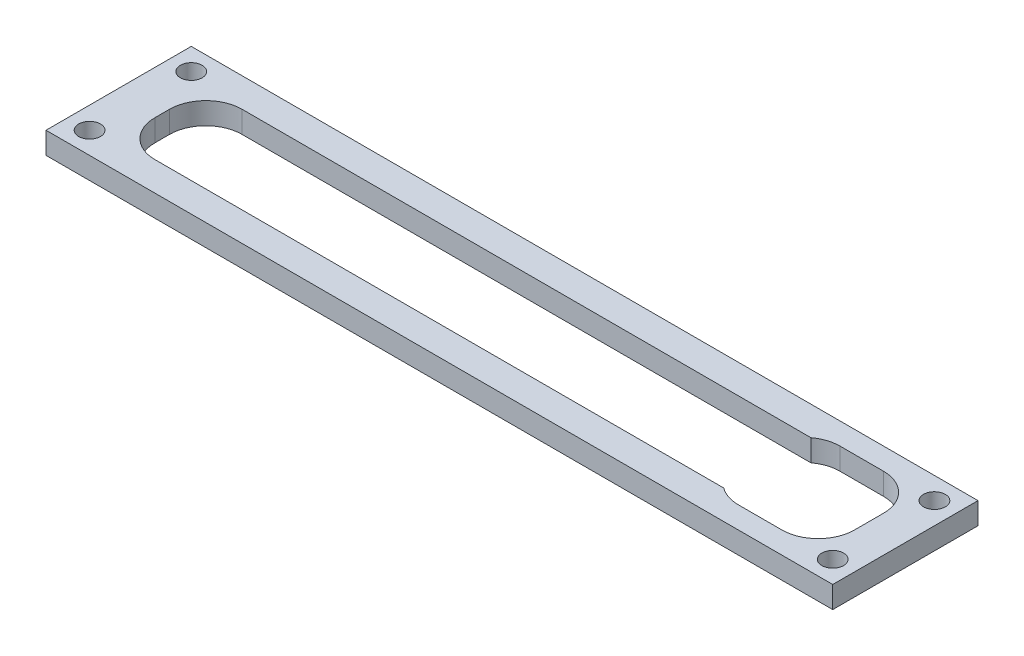
from build123d import *

# Parameters (mm, degrees)
SKETCH1_W           = 108.320866354
SKETCH1_H           = 20
SKETCH1_R           = 1.5
SKETCH1_W_2         = 96.320866354
SKETCH1_H_2         = 12
BOSS_EXTRUDE1_DEPTH = 3
CUT_EXTRUDE1_DEPTH  = 111.192604505
FILLET1_R           = 5


with BuildPart() as part:
    # Sketch1 → Boss-Extrude1 (new body)
    with BuildSketch(Plane(origin=(0, 0, 0), x_dir=(1, 0, 0), z_dir=(0, 1, 0))):
        with Locations((54.160433177, 10)):
            Rectangle(SKETCH1_W, SKETCH1_H)
        with Locations(Location((3, 17, 0), (0, 0, 270))):
            Circle(SKETCH1_R, mode=Mode.SUBTRACT)
        with Locations(Location((3, 3, 0), (0, 0, 90))):
            Circle(SKETCH1_R, mode=Mode.SUBTRACT)
        with Locations(Location((105.320866354, 3, 0), (0, 0, 270))):
            Circle(SKETCH1_R, mode=Mode.SUBTRACT)
        with Locations(Location((105.320866354, 17, 0), (0, 0, 90))):
            Circle(SKETCH1_R, mode=Mode.SUBTRACT)
        with Locations((54.160433177, 10)):
            Rectangle(SKETCH1_W_2, SKETCH1_H_2, mode=Mode.SUBTRACT)
    extrude(amount=BOSS_EXTRUDE1_DEPTH)

    # Sketch2 → Cut-Extrude1 (cut, through all)
    with BuildSketch(Plane(origin=(0, 3, 0), x_dir=(1, 0, 0), z_dir=(0, 1, 0))):
        Polygon((89.320866354, 17), (89.320866354, 16), (102.320866354, 16), (102.320866354, 4), (89.320866354, 4), (89.320866354, 3), (103.320866354, 3), (103.320866354, 17), align=None)
    extrude(amount=-CUT_EXTRUDE1_DEPTH, mode=Mode.SUBTRACT)

    # Fillet1
    # the kernel refuses this fillet: 5 mm, written as the material it adds along each edge
    with BuildSketch(Plane(origin=(103.320866354, 3, -17), x_dir=(0, 0, 1), z_dir=(0, -1, 0)), Plane(origin=(103.320866354, 3, -3), x_dir=(-1, 0, 0), z_dir=(0, -1, 0)), Plane(origin=(6, 0, -16), x_dir=(0, 0, 1), z_dir=(0, 1, 0))) as fillet1_piece_1:
        with BuildLine():
            CenterArc((FILLET1_R, FILLET1_R), FILLET1_R, 180, 90)
            Line((0, FILLET1_R), (-FILLET1_R * 0.02, FILLET1_R))
            Line((-FILLET1_R * 0.02, FILLET1_R), (-FILLET1_R * 0.02, -FILLET1_R * 0.02))
            Line((-FILLET1_R * 0.02, -FILLET1_R * 0.02), (FILLET1_R, -FILLET1_R * 0.02))
            Line((FILLET1_R, -FILLET1_R * 0.02), (FILLET1_R, 0))
        make_face()
    extrude(amount=3)
    with BuildSketch(Plane(origin=(89.320866354, 3, -17), x_dir=(1, 0, 0), z_dir=(0, -1, 0))) as fillet1_piece_2:
        with BuildLine():
            CenterArc((3, 5), FILLET1_R, 233.130102354, 36.869897646)
            Line((0, 1), (-0.06, 0.92))
            ThreePointArc((-0.06, 0.92), (-0.1, 0.5), (-0.1, 0))
            Line((-0.1, 0), (0, -0.1))
            Line((0, -0.1), (3, -0.1))
            Line((3, -0.1), (3, 0))
        make_face()
    extrude(amount=3)
    with BuildSketch(Plane(origin=(89.320866354, 3, -3), x_dir=(0, 0, -1), z_dir=(0, -1, 0))) as fillet1_piece_3:
        with BuildLine():
            CenterArc((5, 3), FILLET1_R, 180, 36.869897646)
            Line((0, 3), (-0.1, 3))
            Line((-0.1, 3), (-0.1, 0))
            Line((-0.1, 0), (0, -0.1))
            ThreePointArc((0, -0.1), (0.5, -0.1), (0.92, -0.06))
            Line((0.92, -0.06), (1, 0))
        make_face()
    extrude(amount=3)
    with BuildSketch(Plane(origin=(6, 0, -4), x_dir=(0, 0, -1), z_dir=(0, 1, 0))) as fillet1_piece_4:
        with BuildLine():
            CenterArc((FILLET1_R, -FILLET1_R), FILLET1_R, 90, 90)
            Line((0, -FILLET1_R), (-FILLET1_R * 0.02, -FILLET1_R))
            Line((-FILLET1_R * 0.02, -FILLET1_R), (-FILLET1_R * 0.02, FILLET1_R * 0.02))
            Line((-FILLET1_R * 0.02, FILLET1_R * 0.02), (FILLET1_R, FILLET1_R * 0.02))
            Line((FILLET1_R, FILLET1_R * 0.02), (FILLET1_R, 0))
        make_face()
    extrude(amount=3)


solid = part.part
